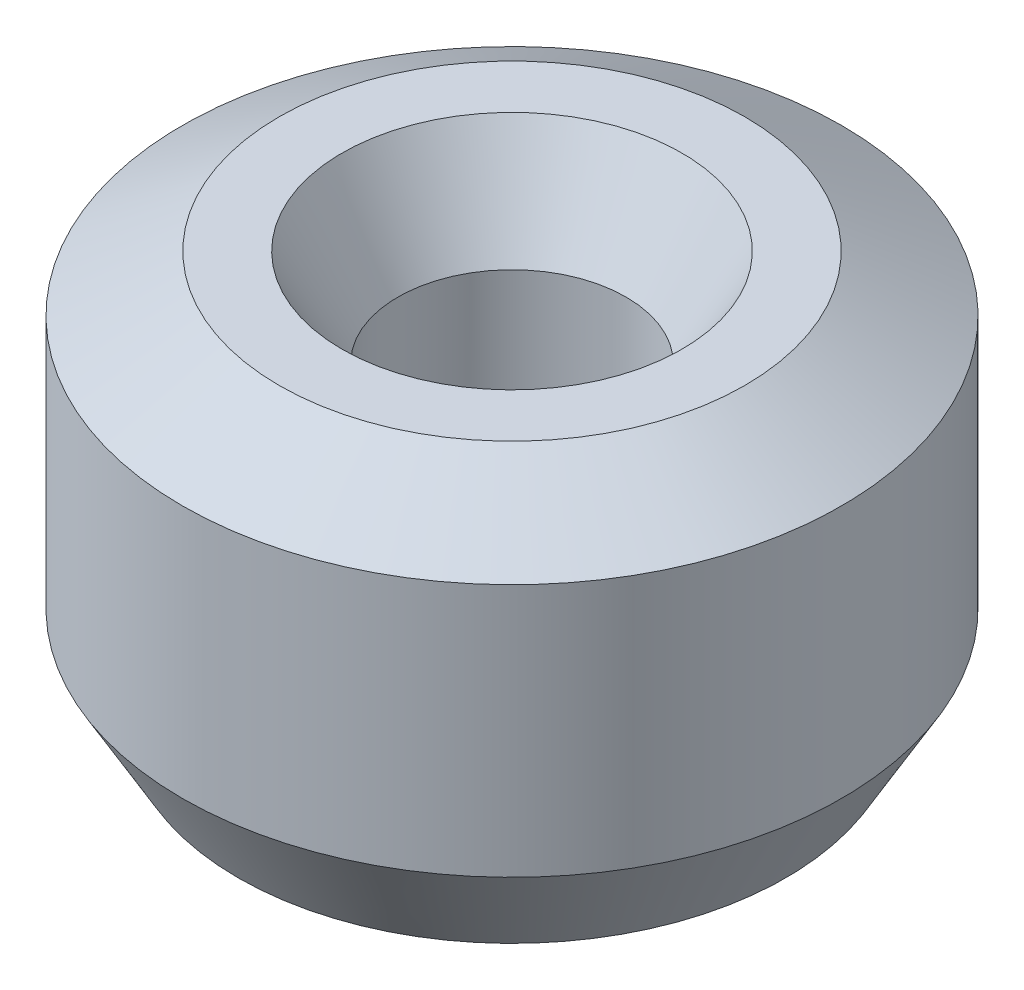
from build123d import *
from OCP.BRepFilletAPI import BRepFilletAPI_MakeChamfer

# Parameters (mm, degrees)
SKETCH1_R           = 5
BOSS_EXTRUDE1_DEPTH = 6.160331318
SKETCH2_R           = 1.730913041
CUT_EXTRUDE1_DEPTH  = 10.378149175
CHAMFER1_SIZE       = 0.847690488
CHAMFER1_SIZE2      = 1.468242994


with BuildPart() as part:
    # Sketch1 → Boss-Extrude1 (new body)
    with BuildSketch(Plane(origin=(0, 0, 0), x_dir=(1, 0, 0), z_dir=(0, 1, 0))):
        Circle(SKETCH1_R)
    extrude(amount=BOSS_EXTRUDE1_DEPTH)

    # Sketch2 → Cut-Extrude1 (cut, through all)
    with BuildSketch(Plane(origin=(0, 0, 0), x_dir=(1, 0, 0), z_dir=(0, 1, 0))):
        Circle(SKETCH2_R)
    extrude(amount=CUT_EXTRUDE1_DEPTH, mode=Mode.SUBTRACT)

    # Chamfer1: one chamfer whose edges measure the first distance from different faces: ONE call of the kernel's chamfer builder (chamfer() names one face for all edges)
    chamfer1_edges_1 = [part.edges().sort_by_distance(p)[0] for p in [
        (-1.730913041, 6.160331318, 0),
    ]]
    chamfer1_side_1 = [part.faces().sort_by_distance(p)[0] for p in [
        (-4.858578644, 6.160331318, 0),
    ]]
    chamfer1_edges_2 = [part.edges().sort_by_distance(p)[0] for p in [
        (-1.730913041, 0, 0),
    ]]
    chamfer1_side_2 = [part.faces().sort_by_distance(p)[0] for p in [
        (-1.730913041, 3.080165659, 0),
    ]]
    chamfer1_edges_3 = [part.edges().sort_by_distance(p)[0] for p in [
        (-5, 0, 0),
    ]]
    chamfer1_side_3 = [part.faces().sort_by_distance(p)[0] for p in [
        (-4.858578644, 0, 0),
    ]]
    chamfer1_edges_4 = [part.edges().sort_by_distance(p)[0] for p in [
        (-5, 6.160331318, 0),
    ]]
    chamfer1_side_4 = [part.faces().sort_by_distance(p)[0] for p in [
        (-5, 3.080165659, 0),
    ]]
    chamfer1 = BRepFilletAPI_MakeChamfer(part.part.solid().wrapped)
    for e in chamfer1_edges_1:
        chamfer1.Add(CHAMFER1_SIZE, CHAMFER1_SIZE2, e.wrapped, chamfer1_side_1[0].wrapped)  # the first distance lies on this face
    for e in chamfer1_edges_2:
        chamfer1.Add(CHAMFER1_SIZE, CHAMFER1_SIZE2, e.wrapped, chamfer1_side_2[0].wrapped)  # the first distance lies on this face
    for e in chamfer1_edges_3:
        chamfer1.Add(CHAMFER1_SIZE, CHAMFER1_SIZE2, e.wrapped, chamfer1_side_3[0].wrapped)  # the first distance lies on this face
    for e in chamfer1_edges_4:
        chamfer1.Add(CHAMFER1_SIZE, CHAMFER1_SIZE2, e.wrapped, chamfer1_side_4[0].wrapped)  # the first distance lies on this face
    add(Compound.cast(chamfer1.Shape()), mode=Mode.REPLACE)


solid = part.part
